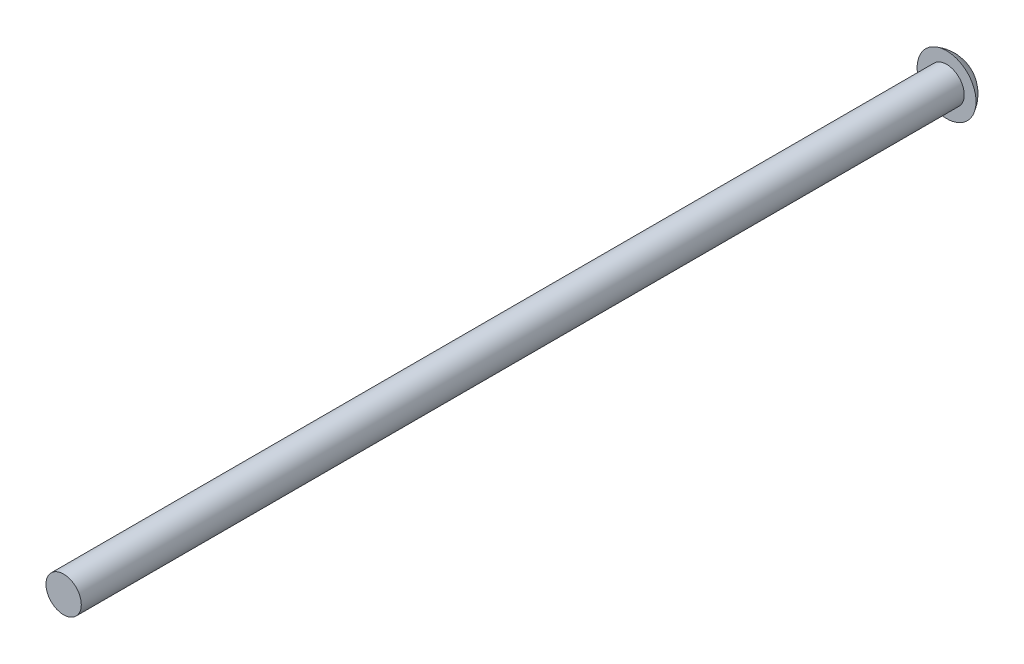
from build123d import *

# Parameters (mm, degrees)
SKETCH_1_R      = 3
EXTRUDE_1_DEPTH = 150


with BuildPart() as part:
    # 草图1 → 凸台-拉伸1 (new body)
    with BuildSketch(Plane.XY):
        Circle(SKETCH_1_R)
    extrude(amount=EXTRUDE_1_DEPTH)

    # 草图2 → 旋转1 (revolve)
    with BuildSketch(Plane(origin=(0, 0, 0), x_dir=(1, 0, 0), z_dir=(0, 1, 0))):
        with BuildLine():
            Line((0, 0), (5, 0))
            ThreePointArc((5, 0), (2.915475947, 2.192459912), (0, 3))
            Line((0, 3), (0, 0))
        make_face()
    revolve(axis=Axis((0, 0, 0), (0, 0, -1)))


solid = part.part
